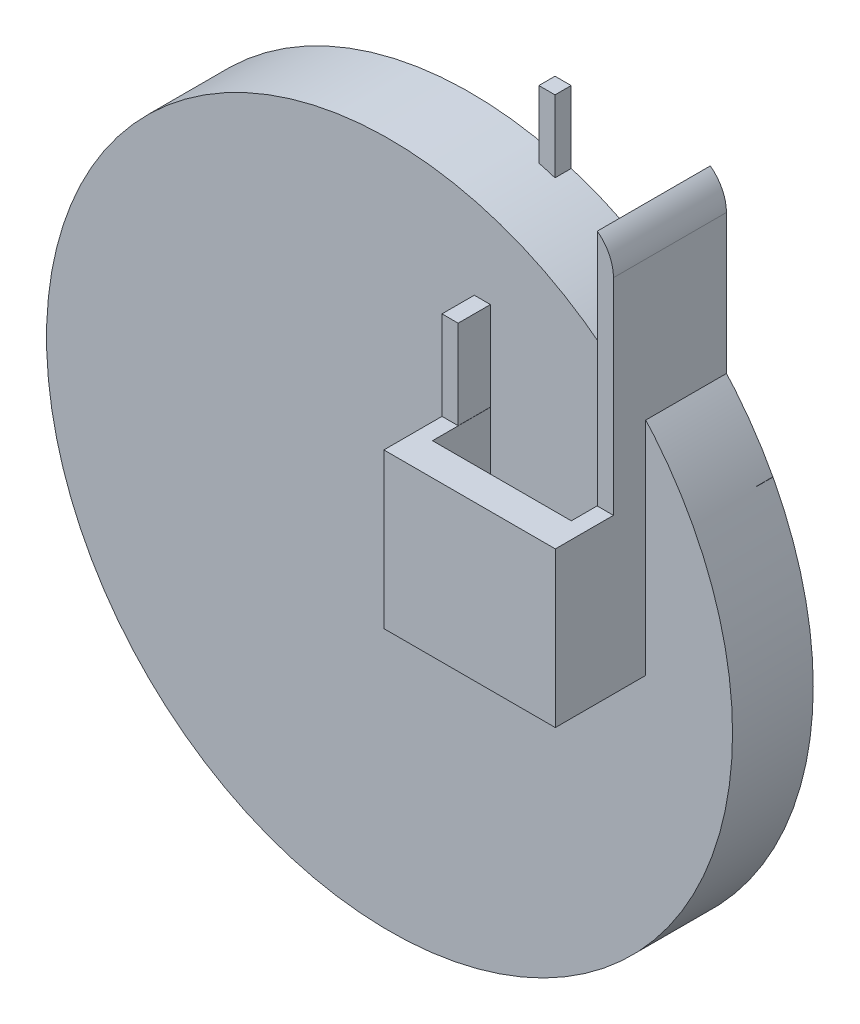
from build123d import *

# Parameters (mm, degrees)
SKETCH4_R           = 42.5
BASE_DEPTH          = 10
SKETCH10_W          = 21.242861366
SKETCH10_H          = 19.174682453
BOSS_EXTRUDE1_DEPTH = 21.2
SKETCH11_W          = 32.5685853
SKETCH11_H          = 48.674682453
BOSS_EXTRUDE2_DEPTH = 2
SKETCH13_W          = 17.2
SKETCH13_H          = 17.2
CUT_EXTRUDE2_DEPTH  = 15.2
BOSS_EXTRUDE4_REACH = 98.435
SKETCH17_W          = 12
SKETCH17_H          = 29.5
SKETCH12_W          = 5.5685853
SKETCH12_H          = 32.757849033
SKETCH12_W_2        = 17.242861366
SKETCH12_W_3        = 5.757138634
CUT_EXTRUDE3_DEPTH  = 14
CUT_EXTRUDE4_REACH  = 98.435
SKETCH18_W          = 3
SKETCH18_H          = 16.454130829
FILLET1_R           = 5
FILLET2_R           = 1
SKETCH19_R          = 1.5
CUT_EXTRUDE5_DEPTH  = 10
SKETCH21_W          = 12
SKETCH21_H          = 18.5
CUT_EXTRUDE6_DEPTH  = 2


with BuildPart() as part:
    # Sketch4 → base (new body)
    with BuildSketch(Plane.XY):
        Circle(SKETCH4_R)
    extrude(amount=BASE_DEPTH)


with BuildPart() as body_2:
    # Sketch10 → Boss-Extrude1 (new body)
    with BuildSketch(Plane.XY):
        with Locations((21.121430683, 10.412658774)):
            Rectangle(SKETCH10_W, SKETCH10_H)
    extrude(amount=BOSS_EXTRUDE1_DEPTH)

    # Sketch11 → Boss-Extrude2 (add)
    with BuildSketch(Plane.XY):
        with Locations((21.21570735, 25.162658773)):
            Rectangle(SKETCH11_W, SKETCH11_H)
    extrude(amount=BOSS_EXTRUDE2_DEPTH)

    # Sketch13 → Cut-Extrude2 (cut)
    with BuildSketch(Plane(origin=(0, 20, 0), x_dir=(1, 0, 0), z_dir=(0, 1, 0))):
        with Locations((21.121430683, -8.6)):
            Rectangle(SKETCH13_W, SKETCH13_H)
    extrude(amount=-CUT_EXTRUDE2_DEPTH, mode=Mode.SUBTRACT)

    # Boss-Extrude4: up to this face of the body (flat: up to its plane)
    boss_extrude4_end = Plane(body_2.part.faces().sort_by_distance((4.9314147, 25.162658774, 1))[0])
    # Sketch17 → Boss-Extrude4 (add, up to the picked face)
    with BuildSketch(Plane(origin=(37.5, 0, 0), x_dir=(0, 0, -1), z_dir=(1, 0, 0)), mode=Mode.PRIVATE) as boss_extrude4_sk1:
        with Locations((-8, 34.75)):
            Rectangle(SKETCH17_W, SKETCH17_H)
    boss_extrude4_tool1 = split(extrude(boss_extrude4_sk1.sketch, amount=-BOSS_EXTRUDE4_REACH, mode=Mode.PRIVATE), bisect_by=boss_extrude4_end, keep=Keep.BOTH, mode=Mode.PRIVATE)
    add(boss_extrude4_tool1.solids().sort_by(Axis((37.5, 34.75, 8), (-1, 0, 0)))[0])

    # Sketch12 → Cut-Extrude3 (cut)
    with BuildSketch(Plane.XY):
        with Locations((7.71570735, 36.378924517)):
            Rectangle(SKETCH12_W, SKETCH12_H)
        with Locations((21.121430683, 36.378924517)):
            Rectangle(SKETCH12_W_2, SKETCH12_H)
        with Locations((34.621430683, 36.378924517)):
            Rectangle(SKETCH12_W_3, SKETCH12_H)
    extrude(amount=CUT_EXTRUDE3_DEPTH, mode=Mode.SUBTRACT)

    # Cut-Extrude4: up to this face of the body (flat: up to its plane)
    cut_extrude4_end = Plane(body_2.part.faces().sort_by_distance((10.5, 23.279933566, 9.167956849))[0])
    # Sketch18 → Cut-Extrude4 (cut, up to the picked face)
    with BuildSketch(Plane(origin=(37.5, 0, 0), x_dir=(0, 0, -1), z_dir=(1, 0, 0)), mode=Mode.PRIVATE) as cut_extrude4_sk1:
        with Locations((-7.5, 19.052382962)):
            Rectangle(SKETCH18_W, SKETCH18_H)
    cut_extrude4_tool1 = split(extrude(cut_extrude4_sk1.sketch, amount=-CUT_EXTRUDE4_REACH, mode=Mode.PRIVATE), bisect_by=cut_extrude4_end, keep=Keep.BOTH, mode=Mode.PRIVATE)
    add(cut_extrude4_tool1.solids().sort_by(Axis((37.5, 19.052383, 7.5), (-1, 0, 0)))[0], mode=Mode.SUBTRACT)

    # Fillet1
    # the kernel refuses this fillet: 5 mm, written as the material it takes off along each edge
    with BuildSketch(Plane(origin=(31.742861366, 49.5, 24), x_dir=(0, -1, 0), z_dir=(0, 0, -1))) as fillet1_piece_1:
        with BuildLine():
            CenterArc((4, 5), FILLET1_R, 216.869897646, 53.130102354)
            Line((0, 2), (-0.08, 1.94))
            ThreePointArc((-0.08, 1.94), (-0.1, 1), (-0.1, 0))
            Line((-0.1, 0), (0, -0.1))
            Line((0, -0.1), (4, -0.1))
            Line((4, -0.1), (4, 0))
        make_face()
    extrude(amount=34, mode=Mode.SUBTRACT)

    # Fillet2
    fillet2_edges = [body_2.edges().sort_by_distance(p)[0] for p in [
        (30.732146025, 10.825317547, 6),
        (11.510715342, 10.825317547, 6),
        (30.742861366, 27.279448376, 6),
        (11.5, 27.279448376, 6),
        (30.732146025, 10.825317547, 9),
        (11.510715342, 10.825317547, 9),
        (30.742861366, 27.279448376, 9),
        (11.5, 27.279448376, 9),
    ]]
    fillet(fillet2_edges, radius=FILLET2_R)

    # Sketch19 → Cut-Extrude5 (cut)
    with BuildSketch(Plane.XY):
        with Locations(Location((7.71570735, 16, 0), (0, 0, 180))):
            Circle(SKETCH19_R)
        with Locations(Location((7.71570735, 4.825317547, 0), (0, 0, 180))):
            Circle(SKETCH19_R)
        with Locations(Location((34.527154016, 4.825317547, 0), (0, 0, 180))):
            Circle(SKETCH19_R)
        with Locations(Location((34.527154016, 16, 0), (0, 0, 180))):
            Circle(SKETCH19_R)
    extrude(amount=CUT_EXTRUDE5_DEPTH, mode=Mode.SUBTRACT)

    # Sketch21 → Cut-Extrude6 (cut)
    with BuildSketch(Plane.ZY.offset(-10.5)):
        with Locations((8, 40.25)):
            Rectangle(SKETCH21_W, SKETCH21_H)
    extrude(amount=-CUT_EXTRUDE6_DEPTH, mode=Mode.SUBTRACT)


solid = Compound([part.part, body_2.part])
